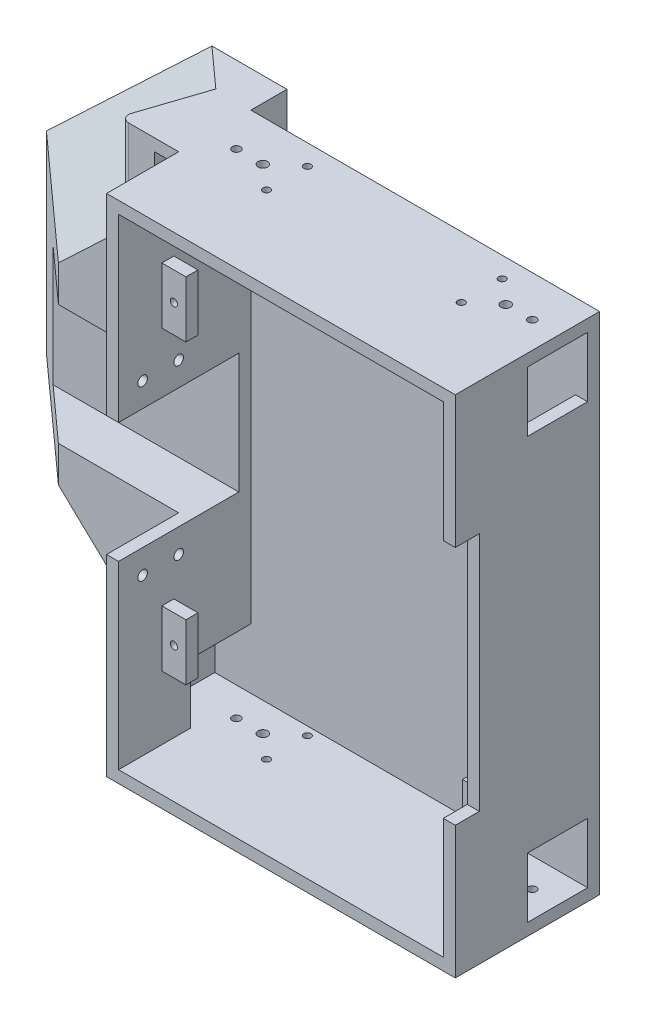
from build123d import *

# Parameters (mm, degrees)
SKETCH1_W                 = 150
SKETCH1_H                 = 250
BOSS_EXTRUDE1_DEPTH       = 30
SKETCH6_W                 = 45
SKETCH6_H                 = 250
BOSS_EXTRUDE3_DEPTH       = 100
CUT_EXTRUDE7_DEPTH        = 133.5
CUT_EXTRUDE10_DEPTH       = 267
CUT_EXTRUDE11_START       = -50
CUT_EXTRUDE11_DEPTH       = 50
CUT_EXTRUDE16_START       = 7.483352464
CUT_EXTRUDE16_DEPTH       = 123.332093593
CUT_EXTRUDE17_REACH       = 310.464
SKETCH18_R                = 2
CUT_EXTRUDE18_DEPTH       = 10
CUT_EXTRUDE19_START       = 110
SKETCH17_W                = 110
SKETCH17_H                = 50
CUT_EXTRUDE19_DEPTH       = 196
FILLET3_R                 = 3
FILLET5_R                 = 3
CUT_EXTRUDE20_DEPTH       = 228.760839479
SKETCH20_W                = 135
SKETCH20_H                = 200
CUT_EXTRUDE21_DEPTH       = 55
SKETCH22_R                = 1.7
SKETCH22_R_2              = 2
SKETCH22_R_3              = 1.5
CUT_EXTRUDE22_DEPTH       = 50
MIRROR4_COPY_1_SKETCH_R   = 1.7
MIRROR4_COPY_1_SKETCH_R_2 = 2
MIRROR4_COPY_1_SKETCH_R_3 = 1.5
MIRROR4_COPY_1_DEPTH      = 50
CUT_EXTRUDE23_START       = -15
SKETCH23_W                = 25
SKETCH23_H                = 25
CUT_EXTRUDE23_DEPTH       = 196.693109996
SKETCH24_W                = 10
SKETCH24_H                = 100
CUT_EXTRUDE24_DEPTH       = 10
SKETCH26_W                = 5
SKETCH26_H                = 23.461459367
BOSS_EXTRUDE4_DEPTH       = 10
SKETCH28_R                = 1.5
CUT_EXTRUDE25_DEPTH       = 10
MIRROR8_COPY_1_SKETCH_R   = 1.5
MIRROR8_COPY_1_DEPTH      = 10


with BuildPart() as part:
    # Sketch1 → Boss-Extrude1 (new, symmetric)
    with BuildSketch(Plane.XY):
        Rectangle(SKETCH1_W, SKETCH1_H)
    extrude(amount=BOSS_EXTRUDE1_DEPTH, both=True)

    # Sketch6 → Boss-Extrude3 (add)
    with BuildSketch(Plane.ZY.offset(75)):
        with Locations((-22.5, 0)):
            Rectangle(SKETCH6_W, SKETCH6_H)
    extrude(amount=BOSS_EXTRUDE3_DEPTH)

    # Sketch9 → Cut-Extrude7 (cut, symmetric)
    with BuildSketch(Plane(origin=(0, 0, 0), x_dir=(1, 0, 0), z_dir=(0, 1, 0))):
        Polygon((-125, 0), (-175, 45), (-175, 0), align=None)
    extrude(amount=CUT_EXTRUDE7_DEPTH, both=True, mode=Mode.SUBTRACT)

    # Sketch13 → Cut-Extrude10 (cut)
    with BuildSketch(Plane(origin=(-49.871615343, 52.805239774, 55.412905936), x_dir=(-0.837852837655121, -0.3765961924075118, -0.3951935352424505), z_dir=(0.5458961645159833, -0.578007703605159, -0.6065512939066482))):
        Polygon((138.497571597, 161.006204915), (149.344107979, 60.001465841), (41.926676236, 121.535971264), align=None)
    cut_extrude10 = extrude(amount=-CUT_EXTRUDE10_DEPTH, mode=Mode.SUBTRACT)

    # Cut-Extrude11: read off the stored shape, not the designer's step
    # Cut-Extrude11 outline → Cut-Extrude11 (cut)
    with BuildSketch(Plane(origin=(-49.871615343, 52.805239774, 55.412905936), x_dir=(-0.837852837655121, -0.3765961924075118, -0.3951935352424505), z_dir=(0.5458961645159833, -0.578007703605159, -0.6065512939066482)).offset(CUT_EXTRUDE11_START)):
        Polygon((149.344107979, 60.001465841), (41.926676236, 121.535971264), (89.667757011, 28.957414317), align=None)
    cut_extrude11 = extrude(amount=CUT_EXTRUDE11_DEPTH, mode=Mode.SUBTRACT)

    # Cut-Extrude16: read off the stored shape, not the designer's step
    # Cut-Extrude16 outline → Cut-Extrude16 (cut)
    with BuildSketch(Plane(origin=(0, 0, 0), x_dir=(0.98112989145127, -0.1559406555847297, 0.11430943984039024), z_dir=(0.19334977657297428, 0.7913018633819886, -0.5800493297189246)).offset(CUT_EXTRUDE16_START)):
        Polygon((-117.605571093, -73.90068007), (-108.032547514, -37.607234969), (-131.340301245, -22), (-144, -22), (-144, -75), (-117.895535729, -75), align=None)
    extrude(amount=CUT_EXTRUDE16_DEPTH, mode=Mode.SUBTRACT)

    # Mirror2: Cut-Extrude10, Cut-Extrude11 across plane
    add(cut_extrude10.mirror(Plane.ZX), mode=Mode.SUBTRACT)
    add(cut_extrude11.mirror(Plane.ZX), mode=Mode.SUBTRACT)

    # Cut-Extrude17: up to this face of the body (flat: up to its plane)
    cut_extrude17_end = Plane(part.part.faces().sort_by_distance((-128.333333334, -68.333333333, -30))[0])
    # Sketch15 → Cut-Extrude17 (cut, up to the picked face)
    with BuildSketch(Plane.XZ.offset(125), mode=Mode.PRIVATE) as cut_extrude17_sk1:
        Polygon((-125.332336707, 0), (-100, 0), (-85, -45), align=None)
    cut_extrude17_tool1 = split(extrude(cut_extrude17_sk1.sketch, amount=-CUT_EXTRUDE17_REACH, mode=Mode.PRIVATE), bisect_by=cut_extrude17_end, keep=Keep.BOTH, mode=Mode.PRIVATE)
    add(cut_extrude17_tool1.solids().sort_by(Axis((-103.444112, -125, -15), (0, 1, 0)))[0], mode=Mode.SUBTRACT)

    # Sketch18 → Cut-Extrude18 (cut)
    with BuildSketch(Plane.ZY.offset(75)):
        with Locations((5, -35)):
            Circle(SKETCH18_R)
        with Locations((20, -35)):
            Circle(SKETCH18_R)
        with Locations((5, 35)):
            Circle(SKETCH18_R)
        with Locations((20, 35)):
            Circle(SKETCH18_R)
    extrude(amount=-CUT_EXTRUDE18_DEPTH, mode=Mode.SUBTRACT)

    # Sketch17 → Cut-Extrude19 (cut)
    with BuildSketch(Plane.ZY.offset(75).offset(CUT_EXTRUDE19_START)):
        with Locations((35, 0)):
            Rectangle(SKETCH17_W, SKETCH17_H)
    extrude(amount=-CUT_EXTRUDE19_DEPTH, mode=Mode.SUBTRACT)

    # Fillet3
    # the kernel refuses this fillet: 3 mm, written as the material it takes off along each edge
    with BuildSketch(Plane(origin=(-95.83772234, -122, -3), x_dir=(-0.9486832980505141, 0, -0.3162277660168372), z_dir=(0, -1, 0))) as fillet3_piece_1_section:
        Polygon((0, 0), (FILLET3_R * 1.02, 0), (FILLET3_R * 1.02, -FILLET3_R * 1.41517440446), (-FILLET3_R * 0.322552321337, -FILLET3_R * 0.967656964012), align=None)
    fillet3_piece_1 = extrude(amount=FILLET3_R * 1.02, mode=Mode.PRIVATE)
    fillet3_piece_1 = fillet3_piece_1 - Plane(origin=(-95.83772234, -122, -3), x_dir=(0.8112421851755607, 0, -0.5847102846637652), z_dir=(0, -1, 0)) * Sphere(FILLET3_R, mode=Mode.PRIVATE)
    add(fillet3_piece_1, mode=Mode.SUBTRACT)
    with BuildSketch(Plane(origin=(-75, -125, 0), x_dir=(0, 0, -1), z_dir=(-1, 0, 0))) as fillet3_piece_2:
        with BuildLine():
            CenterArc((FILLET3_R, -FILLET3_R), FILLET3_R, 90, 90)
            Line((0, -FILLET3_R), (0, 0))
            Line((0, 0), (FILLET3_R, 0))
        make_face()
    extrude(amount=20.83772234, mode=Mode.SUBTRACT)
    with BuildSketch(Plane(origin=(-98.683772234, -125, -3.948683298), x_dir=(0.9486832980505141, 0, 0.3162277660168373), z_dir=(0.3162277660168372, 0, -0.9486832980505141))) as fillet3_piece_3_section:
        with BuildLine():
            CenterArc((FILLET3_R, -FILLET3_R), FILLET3_R, 90, 90)
            Line((0, -FILLET3_R), (0, 0))
            Line((0, 0), (FILLET3_R, 0))
        make_face()
    fillet3_piece_3 = extrude(amount=50.771887242, mode=Mode.PRIVATE)
    fillet3_piece_3 = split(fillet3_piece_3, bisect_by=Plane(origin=(-81.013305522, -106.290094069, -23.5825352), z_dir=(-0.5458961645159834, -0.5780077036051591, 0.6065512939066484)), keep=Keep.TOP, mode=Mode.PRIVATE)
    add(fillet3_piece_3, mode=Mode.SUBTRACT)
    with BuildSketch(Plane(origin=(-100, -122, 0), x_dir=(0.3162277660168381, 0, -0.9486832980505137), z_dir=(0, 1, 0))) as fillet3_piece_4_section:
        with BuildLine():
            CenterArc((FILLET3_R * 1.38742588672, -FILLET3_R), FILLET3_R, 90, 108.434948823)
            Line((FILLET3_R * 0.438742588672, -FILLET3_R * 1.31622776602), (0, 0))
            Line((0, 0), (FILLET3_R * 1.38742588672, 0))
        make_face()
    fillet3_piece_4 = extrude(amount=68.794583039, mode=Mode.PRIVATE)
    fillet3_piece_4 = split(fillet3_piece_4, bisect_by=Plane(origin=(-81.576426107, -102.492686466, -20.470637659), z_dir=(-0.5458961645159834, -0.5780077036051591, 0.6065512939066484)), keep=Keep.TOP, mode=Mode.PRIVATE)
    add(fillet3_piece_4, mode=Mode.SUBTRACT)

    # Fillet5
    # the kernel refuses this fillet: 3 mm, written as the material it takes off along each edge
    with BuildSketch(Plane(origin=(-95.83772234, 122, -3), x_dir=(-0.9486832980504565, -1.410260797030105e-13, -0.31622776601701025), z_dir=(0, 1, 0))) as fillet5_piece_1_section:
        Polygon((0, 0), (FILLET5_R * 1.02, 0), (FILLET5_R * 1.02, FILLET5_R * 1.41517440446), (-FILLET5_R * 0.322552321337, FILLET5_R * 0.967656964011), align=None)
    fillet5_piece_1 = extrude(amount=FILLET5_R * 1.02, mode=Mode.PRIVATE)
    fillet5_piece_1 = fillet5_piece_1 - Plane(origin=(-95.83772234, 122, -3), x_dir=(0.8112421851756141, 1.2049011170048047e-13, -0.5847102846636912), z_dir=(0, 1, 0)) * Sphere(FILLET5_R, mode=Mode.PRIVATE)
    add(fillet5_piece_1, mode=Mode.SUBTRACT)
    with BuildSketch(Plane(origin=(-75, 125, 0), x_dir=(0, 0, -1), z_dir=(-1, 0, 0))) as fillet5_piece_2:
        with BuildLine():
            CenterArc((FILLET5_R, FILLET5_R), FILLET5_R, 180, 90)
            Line((0, FILLET5_R), (0, 0))
            Line((0, 0), (FILLET5_R, 0))
        make_face()
    extrude(amount=20.83772234, mode=Mode.SUBTRACT)
    with BuildSketch(Plane(origin=(-82.628291755, 125, -52.115124735), x_dir=(0.9486832980504564, 0, 0.31622776601701025), z_dir=(-0.31622776601701025, 0, 0.9486832980504565))) as fillet5_piece_3_section:
        with BuildLine():
            CenterArc((FILLET5_R, -FILLET5_R), FILLET5_R, 90, 90)
            Line((0, -FILLET5_R), (0, 0))
            Line((0, 0), (FILLET5_R, 0))
        make_face()
    fillet5_piece_3 = extrude(amount=50.771887242, mode=Mode.PRIVATE)
    fillet5_piece_3 = split(fillet5_piece_3, bisect_by=Plane(origin=(-85.69098462, 128.24285127, -48.712132662), z_dir=(-0.5458961645131595, 0.5780077036058499, 0.6065512939085316)), keep=Keep.TOP, mode=Mode.PRIVATE)
    add(fillet5_piece_3, mode=Mode.SUBTRACT)
    with BuildSketch(Plane(origin=(-100, 53.205416961, 0), x_dir=(0.31622776601701785, 4.687960412721508e-14, -0.9486832980504537), z_dir=(0, 1, 0))) as fillet5_piece_4_section:
        with BuildLine():
            CenterArc((FILLET5_R * 1.38742588672, -FILLET5_R), FILLET5_R, 90, 108.434948823)
            Line((FILLET5_R * 0.438742588673, -FILLET5_R * 1.31622776602), (0, 0))
            Line((0, 0), (FILLET5_R * 1.38742588672, 0))
        make_face()
    fillet5_piece_4 = extrude(amount=68.794583039, mode=Mode.PRIVATE)
    fillet5_piece_4 = split(fillet5_piece_4, bisect_by=Plane(origin=(-103.283331447, 56.681885553, 3.648146053), z_dir=(-0.5458961645131595, 0.5780077036058499, 0.6065512939085316)), keep=Keep.TOP, mode=Mode.PRIVATE)
    add(fillet5_piece_4, mode=Mode.SUBTRACT)

    # Sketch19 → Cut-Extrude20 (cut, through all)
    with BuildSketch(Plane.XY.offset(30)):
        Polygon((-113.013501494, -125), (75, -125), (75, 125), (-115.323741981, 125), (-115.323741981, 105), (70, 105), (70, -105), (-113.013501494, -105), align=None)
    extrude(amount=-CUT_EXTRUDE20_DEPTH, mode=Mode.SUBTRACT)

    # Sketch20 → Cut-Extrude21 (cut)
    with BuildSketch(Plane.XY.offset(30)):
        with Locations((-2.5, 0)):
            Rectangle(SKETCH20_W, SKETCH20_H)
    extrude(amount=-CUT_EXTRUDE21_DEPTH, mode=Mode.SUBTRACT)

    # Sketch22 → Cut-Extrude22 (cut)
    with BuildSketch(Plane.XZ.offset(-100)):
        with Locations(Location((-64, -13, 0), (0, 0, 270))):
            Circle(SKETCH22_R)
        with Locations(Location((-53, -13, 0), (0, 0, 270))):
            Circle(SKETCH22_R_2)
        with Locations(Location((-43, -4.5, 0), (0, 0, 270))):
            Circle(SKETCH22_R_3)
        with Locations(Location((-43, -21.5, 0), (0, 0, 270))):
            Circle(SKETCH22_R_3)
    cut_extrude22 = extrude(amount=-CUT_EXTRUDE22_DEPTH, mode=Mode.SUBTRACT)

    # Mirror3: Cut-Extrude22 across plane
    add(cut_extrude22.mirror(Plane(origin=(-2.5, 0, 0), x_dir=(0, 0, 1), z_dir=(1, 0, 0))), mode=Mode.SUBTRACT)

    # Mirror4: Cut-Extrude22 across plane
    add(cut_extrude22.mirror(Plane.ZX), mode=Mode.SUBTRACT)

    # Mirror4 copy 1 sketch → Mirror4 copy 1 (cut)
    with BuildSketch(Plane(origin=(-5, -100, 0), x_dir=(-1, 0, 0), z_dir=(0, 1, 0))):
        with Locations(Location((-64, -13, 0), (0, 0, 270))):
            Circle(MIRROR4_COPY_1_SKETCH_R)
        with Locations(Location((-53, -13, 0), (0, 0, 270))):
            Circle(MIRROR4_COPY_1_SKETCH_R_2)
        with Locations(Location((-43, -4.5, 0), (0, 0, 270))):
            Circle(MIRROR4_COPY_1_SKETCH_R_3)
        with Locations(Location((-43, -21.5, 0), (0, 0, 270))):
            Circle(MIRROR4_COPY_1_SKETCH_R_3)
    extrude(amount=-MIRROR4_COPY_1_DEPTH, mode=Mode.SUBTRACT)

    # Sketch23 → Cut-Extrude23 (cut)
    with BuildSketch(Plane(origin=(-70, 0, 0), x_dir=(0, 0, -1), z_dir=(1, 0, 0)).offset(CUT_EXTRUDE23_START)):
        with Locations((12.5, 87.5)):
            Rectangle(SKETCH23_W, SKETCH23_H)
    cut_extrude23 = extrude(amount=CUT_EXTRUDE23_DEPTH, mode=Mode.SUBTRACT)

    # Mirror5: Cut-Extrude23 across plane
    add(cut_extrude23.mirror(Plane.ZX), mode=Mode.SUBTRACT)

    # Sketch24 → Cut-Extrude24 (cut)
    with BuildSketch(Plane(origin=(70, 0, 0), x_dir=(0, 0, -1), z_dir=(1, 0, 0))):
        with Locations((-25, 0)):
            Rectangle(SKETCH24_W, SKETCH24_H)
    extrude(amount=-CUT_EXTRUDE24_DEPTH, mode=Mode.SUBTRACT)

    # Sketch26 → Boss-Extrude4 (add)
    with BuildSketch(Plane(origin=(-70, 0, 0), x_dir=(0, 0, -1), z_dir=(1, 0, 0))):
        with Locations((-9.5, 61.730729684)):
            Rectangle(SKETCH26_W, SKETCH26_H)
        with Locations((-9.5, -61.730729684)):
            Rectangle(SKETCH26_W, SKETCH26_H)
    boss_extrude4 = extrude(amount=BOSS_EXTRUDE4_DEPTH)

    # Mirror6: Boss-Extrude4 across plane
    add(boss_extrude4.mirror(Plane(origin=(-2.5, 0, 0), x_dir=(0, 0, 1), z_dir=(1, 0, 0))))

    # Sketch28 → Cut-Extrude25 (cut)
    with BuildSketch(Plane.XY.offset(12)):
        with Locations((-65, 61.730729684)):
            Circle(SKETCH28_R)
    cut_extrude25 = extrude(amount=-CUT_EXTRUDE25_DEPTH, mode=Mode.SUBTRACT)

    # Mirror7: Cut-Extrude25 across plane
    add(cut_extrude25.mirror(Plane.ZX), mode=Mode.SUBTRACT)

    # Mirror8: Cut-Extrude25 across plane
    add(cut_extrude25.mirror(Plane(origin=(-2.5, 0, 0), x_dir=(0, 0, 1), z_dir=(1, 0, 0))), mode=Mode.SUBTRACT)

    # Mirror8 copy 1 sketch → Mirror8 copy 1 (cut)
    with BuildSketch(Plane(origin=(-5, 0, 12), x_dir=(-1, 0, 0), z_dir=(0, 0, 1))):
        with Locations((-65, 61.730729684)):
            Circle(MIRROR8_COPY_1_SKETCH_R)
    extrude(amount=-MIRROR8_COPY_1_DEPTH, mode=Mode.SUBTRACT)


solid = part.part
